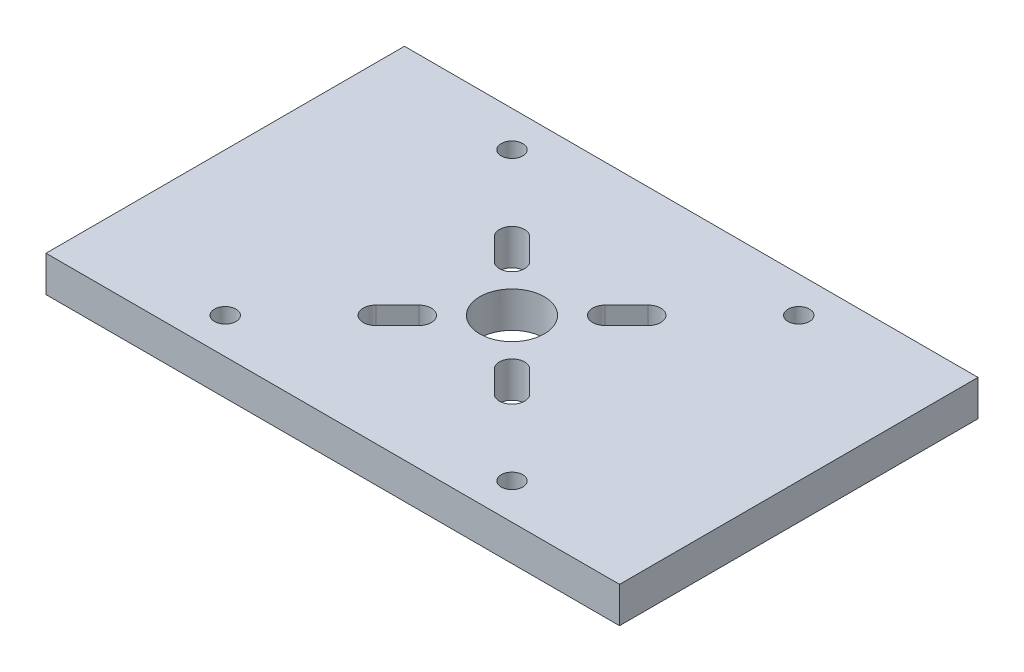
from build123d import *

# Parameters (mm, degrees)
SKETCH1_W          = 160
SKETCH1_H          = 100
BASE_DEPTH         = 10
SKETCH2_R          = 9
ACTUATOR_CUT_DEPTH = 40
CUT_EXTRUDE1_REACH = 96.868
CUT_EXTRUDE2_REACH = 96.868
SKETCH5_R          = 3


with BuildPart() as part:
    # Sketch1 → base (new body)
    with BuildSketch(Plane(origin=(0, 0, 0), x_dir=(1, 0, 0), z_dir=(0, 1, 0))):
        Rectangle(SKETCH1_W, SKETCH1_H)
    extrude(amount=BASE_DEPTH)

    # Sketch2 → actuator cut (cut)
    with BuildSketch(Plane(origin=(0, 10, 0), x_dir=(1, 0, 0), z_dir=(0, 1, 0))):
        Circle(SKETCH2_R)
    extrude(amount=-ACTUATOR_CUT_DEPTH, mode=Mode.SUBTRACT)

    # Sketch3 → Cut-Extrude1 (cut, up to next)
    with BuildSketch(Plane(origin=(0, 10, 0), x_dir=(1, 0, 0), z_dir=(0, 1, 0)), mode=Mode.PRIVATE) as cut_extrude1_sk1:
        with BuildLine():
            Line((-21.474873734, -16.525126266), (-15.474873734, -10.525126266))
            ThreePointArc((-15.474873734, -10.525126266), (-10.525126266, -10.525126266), (-10.525126266, -15.474873734))
            Line((-10.525126266, -15.474873734), (-16.525126266, -21.474873734))
            ThreePointArc((-16.525126266, -21.474873734), (-21.474873734, -21.474873734), (-21.474873734, -16.525126266))
        make_face()
    cut_extrude1_tool1 = extrude(cut_extrude1_sk1.sketch, amount=-CUT_EXTRUDE1_REACH, mode=Mode.PRIVATE) & part.part
    # Sketch3 → Cut-Extrude1 (cut, up to next)
    with BuildSketch(Plane(origin=(0, 10, 0), x_dir=(1, 0, 0), z_dir=(0, 1, 0)), mode=Mode.PRIVATE) as cut_extrude1_sk2:
        with BuildLine():
            Line((21.474873734, -16.525126266), (15.474873734, -10.525126266))
            ThreePointArc((15.474873734, -10.525126266), (10.525126266, -10.525126266), (10.525126266, -15.474873734))
            Line((10.525126266, -15.474873734), (16.525126266, -21.474873734))
            ThreePointArc((16.525126266, -21.474873734), (21.474873734, -21.474873734), (21.474873734, -16.525126266))
        make_face()
    cut_extrude1_tool2 = extrude(cut_extrude1_sk2.sketch, amount=-CUT_EXTRUDE1_REACH, mode=Mode.PRIVATE) & part.part
    # Sketch3 → Cut-Extrude1 (cut, up to next)
    with BuildSketch(Plane(origin=(0, 10, 0), x_dir=(1, 0, 0), z_dir=(0, 1, 0)), mode=Mode.PRIVATE) as cut_extrude1_sk3:
        with BuildLine():
            Line((21.474873734, 16.525126266), (15.474873734, 10.525126266))
            ThreePointArc((15.474873734, 10.525126266), (10.525126266, 10.525126266), (10.525126266, 15.474873734))
            Line((10.525126266, 15.474873734), (16.525126266, 21.474873734))
            ThreePointArc((16.525126266, 21.474873734), (21.474873734, 21.474873734), (21.474873734, 16.525126266))
        make_face()
    cut_extrude1_tool3 = extrude(cut_extrude1_sk3.sketch, amount=-CUT_EXTRUDE1_REACH, mode=Mode.PRIVATE) & part.part
    # Sketch3 → Cut-Extrude1 (cut, up to next)
    with BuildSketch(Plane(origin=(0, 10, 0), x_dir=(1, 0, 0), z_dir=(0, 1, 0)), mode=Mode.PRIVATE) as cut_extrude1_sk4:
        with BuildLine():
            Line((-21.474873734, 16.525126266), (-15.474873734, 10.525126266))
            ThreePointArc((-15.474873734, 10.525126266), (-10.525126266, 10.525126266), (-10.525126266, 15.474873734))
            Line((-10.525126266, 15.474873734), (-16.525126266, 21.474873734))
            ThreePointArc((-16.525126266, 21.474873734), (-21.474873734, 21.474873734), (-21.474873734, 16.525126266))
        make_face()
    cut_extrude1_tool4 = extrude(cut_extrude1_sk4.sketch, amount=-CUT_EXTRUDE1_REACH, mode=Mode.PRIVATE) & part.part
    add(cut_extrude1_tool1.solids().sort_by_distance((-16, 10, 16))[0], mode=Mode.SUBTRACT)
    add(cut_extrude1_tool2.solids().sort_by_distance((16, 10, 16))[0], mode=Mode.SUBTRACT)
    add(cut_extrude1_tool3.solids().sort_by_distance((16, 10, -16))[0], mode=Mode.SUBTRACT)
    add(cut_extrude1_tool4.solids().sort_by_distance((-16, 10, -16))[0], mode=Mode.SUBTRACT)

    # Sketch5 → Cut-Extrude2 (cut, up to next)
    with BuildSketch(Plane(origin=(0, 10, 0), x_dir=(1, 0, 0), z_dir=(0, 1, 0)), mode=Mode.PRIVATE) as cut_extrude2_sk1:
        with Locations((-40, -40)):
            Circle(SKETCH5_R)
    cut_extrude2_tool1 = extrude(cut_extrude2_sk1.sketch, amount=-CUT_EXTRUDE2_REACH, mode=Mode.PRIVATE) & part.part
    # Sketch5 → Cut-Extrude2 (cut, up to next)
    with BuildSketch(Plane(origin=(0, 10, 0), x_dir=(1, 0, 0), z_dir=(0, 1, 0)), mode=Mode.PRIVATE) as cut_extrude2_sk2:
        with Locations((-40, 40)):
            Circle(SKETCH5_R)
    cut_extrude2_tool2 = extrude(cut_extrude2_sk2.sketch, amount=-CUT_EXTRUDE2_REACH, mode=Mode.PRIVATE) & part.part
    # Sketch5 → Cut-Extrude2 (cut, up to next)
    with BuildSketch(Plane(origin=(0, 10, 0), x_dir=(1, 0, 0), z_dir=(0, 1, 0)), mode=Mode.PRIVATE) as cut_extrude2_sk3:
        with Locations((40, -40)):
            Circle(SKETCH5_R)
    cut_extrude2_tool3 = extrude(cut_extrude2_sk3.sketch, amount=-CUT_EXTRUDE2_REACH, mode=Mode.PRIVATE) & part.part
    # Sketch5 → Cut-Extrude2 (cut, up to next)
    with BuildSketch(Plane(origin=(0, 10, 0), x_dir=(1, 0, 0), z_dir=(0, 1, 0)), mode=Mode.PRIVATE) as cut_extrude2_sk4:
        with Locations((40, 40)):
            Circle(SKETCH5_R)
    cut_extrude2_tool4 = extrude(cut_extrude2_sk4.sketch, amount=-CUT_EXTRUDE2_REACH, mode=Mode.PRIVATE) & part.part
    add(cut_extrude2_tool1.solids().sort_by_distance((-40, 10, 40))[0], mode=Mode.SUBTRACT)
    add(cut_extrude2_tool2.solids().sort_by_distance((-40, 10, -40))[0], mode=Mode.SUBTRACT)
    add(cut_extrude2_tool3.solids().sort_by_distance((40, 10, 40))[0], mode=Mode.SUBTRACT)
    add(cut_extrude2_tool4.solids().sort_by_distance((40, 10, -40))[0], mode=Mode.SUBTRACT)


solid = part.part
